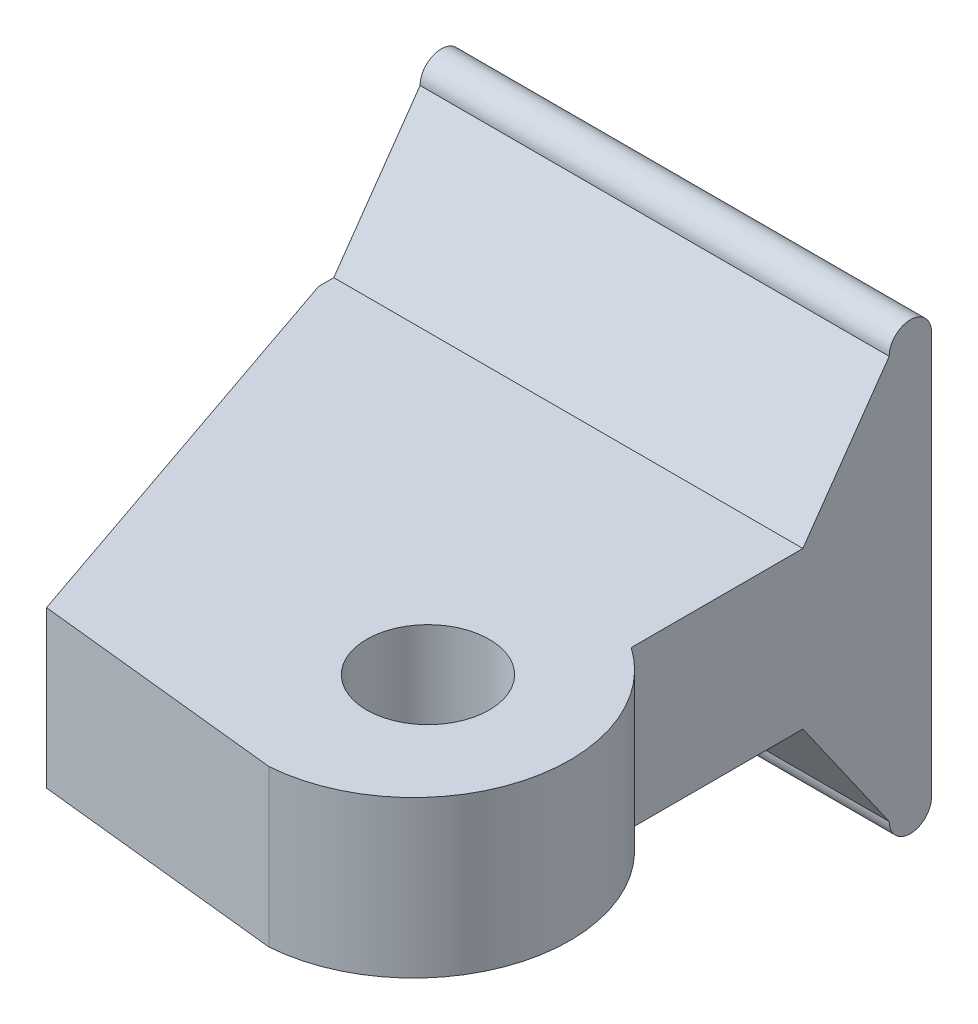
from build123d import *

# Parameters (mm, degrees)
SKETCH1_R               = 2.4892
BOSS_EXTRUDE1_DEPTH     = 6.35
BOSS_EXTRUDE2_START     = -6.35
BOSS_EXTRUDE2_DEPTH     = 19.05
BOSS_EXTRUDE2_START_2   = -6.555460136
BOSS_EXTRUDE2_2_DEPTH   = 19.460920272
BOSS_EXTRUDE2_START_3   = -10
BOSS_EXTRUDE2_3_DEPTH   = 3.65
CUT_EXTRUDE1_DEPTH      = 27.910448217
CUT_EXTRUDE1_DEPTH_BACK = 27.910448217
SKETCH3_W               = 2.179354936
SKETCH3_H               = 6.35
CUT_EXTRUDE2_DEPTH      = 31.98795935
CUT_EXTRUDE2_DEPTH_BACK = 31.98795935


with BuildPart() as part:
    # Sketch1 → Boss-Extrude1 (new body)
    with BuildSketch(Plane(origin=(0, 0, 0), x_dir=(1, 0, 0), z_dir=(0, 1, 0))):
        with BuildLine():
            Line((9.525, -17.889269346), (-0.578271622, -16.817120786))
            Line((-0.578271622, -16.817120786), (-6.35, 0))
            Line((-6.35, 0), (12.7, 0))
            Line((12.7, 0), (12.7, -6.35))
            ThreePointArc((12.7, -6.35), (15.186560179, -13.240601753), (9.525, -17.889269346))
        make_face()
        with Locations(Location((9.525, -11.43, 0), (0, 0, 270))):
            Circle(SKETCH1_R, mode=Mode.SUBTRACT)
    extrude(amount=BOSS_EXTRUDE1_DEPTH)

    # Boss-Extrude2: read off the stored shape, not the designer's step
    # Boss-Extrude2 outline → Boss-Extrude2 (add)
    with BuildSketch(Plane.YZ.offset(BOSS_EXTRUDE2_START)):
        with BuildLine():
            ThreePointArc((11.551615481, -6.35), (12.905510296, -4.996105185), (11.551615481, -3.642210371))
            Line((11.551615481, -3.642210371), (6.35, 0))
            Line((6.35, 0), (0, 0))
            Line((0, 0), (-5.201615481, -3.642210371))
            ThreePointArc((-5.201615481, -3.642210371), (-6.555510296, -4.996105185), (-5.201615481, -6.35))
            Line((-5.201615481, -6.35), (11.551615481, -6.35))
        make_face()
    extrude(amount=BOSS_EXTRUDE2_DEPTH)

    # Boss-Extrude2 2 outline → Boss-Extrude2 2 (add)
    with BuildSketch(Plane(origin=(0, 0, 0), x_dir=(1, 0, 0), z_dir=(0, 1, 0)).offset(BOSS_EXTRUDE2_START_2)):
        Polygon((-8.529354936, 6.35), (-6.35, 0), (-6.35, 6.35), align=None)
    extrude(amount=BOSS_EXTRUDE2_2_DEPTH)

    # Boss-Extrude2 3 outline → Boss-Extrude2 3 (cut)
    with BuildSketch(Plane.YZ.offset(BOSS_EXTRUDE2_START_3)):
        with BuildLine():
            Line((12.905460136, 0), (6.35, 0))
            Line((6.35, 0), (11.551615481, -3.642210371))
            ThreePointArc((11.551615481, -3.642210371), (12.504834401, -4.034645431), (12.905460136, -4.984450993))
            Line((12.905460136, -4.984450993), (12.905460136, 0))
        make_face()
        with BuildLine():
            ThreePointArc((12.905460136, -5.007759378), (12.504834401, -5.95756494), (11.551615481, -6.35))
            Line((11.551615481, -6.35), (12.905460136, -6.35))
            Line((12.905460136, -6.35), (12.905460136, -5.007759378))
        make_face()
        with BuildLine():
            Line((0, 0), (-6.555460136, 0))
            Line((-6.555460136, 0), (-6.555460136, -4.984450993))
            ThreePointArc((-6.555460136, -4.984450993), (-6.154834401, -4.034645431), (-5.201615481, -3.642210371))
            Line((-5.201615481, -3.642210371), (0, 0))
        make_face()
        with BuildLine():
            ThreePointArc((-5.201615481, -6.35), (-6.154834401, -5.95756494), (-6.555460136, -5.007759378))
            Line((-6.555460136, -5.007759378), (-6.555460136, -6.35))
            Line((-6.555460136, -6.35), (-5.201615481, -6.35))
        make_face()
    extrude(amount=BOSS_EXTRUDE2_3_DEPTH, mode=Mode.SUBTRACT)

    # Sketch3 → Cut-Extrude1 (cut, two sides: drawn at the far end of the back side and taken through both)
    with BuildSketch(Plane.XZ.offset(-CUT_EXTRUDE1_DEPTH_BACK)):
        with Locations((-7.439677468, -3.175)):
            Rectangle(SKETCH3_W, SKETCH3_H)
    extrude(amount=CUT_EXTRUDE1_DEPTH + CUT_EXTRUDE1_DEPTH_BACK, mode=Mode.SUBTRACT)

    # Sketch4 → Cut-Extrude2 (cut, two sides: drawn at the far end of the back side and taken through both)
    with BuildSketch(Plane.ZY.offset(6.35).offset(-CUT_EXTRUDE2_DEPTH_BACK)):
        with BuildLine():
            ThreePointArc((-5.842, -5.006022622), (-4.983704134, -5.864318488), (-4.125408268, -5.006022622))
            Line((-4.125408268, -5.006022622), (-0.620153491, 0))
            Line((-0.620153491, 0), (0, 0))
            Line((0, 0), (-3.642210371, -5.201615481))
            ThreePointArc((-3.642210371, -5.201615481), (-4.996105185, -6.555510296), (-6.35, -5.201615481))
            Line((-6.35, -5.201615481), (-6.35, 11.551615481))
            ThreePointArc((-6.35, 11.551615481), (-4.996105185, 12.905510296), (-3.642210371, 11.551615481))
            Line((-3.642210371, 11.551615481), (0, 6.35))
            Line((0, 6.35), (-0.620153491, 6.35))
            Line((-0.620153491, 6.35), (-4.125408268, 11.356022622))
            ThreePointArc((-4.125408268, 11.356022622), (-4.983704134, 12.214318488), (-5.842, 11.356022622))
            Line((-5.842, 11.356022622), (-5.842, -5.006022622))
        make_face()
    extrude(amount=CUT_EXTRUDE2_DEPTH + CUT_EXTRUDE2_DEPTH_BACK, mode=Mode.SUBTRACT)


solid = part.part
